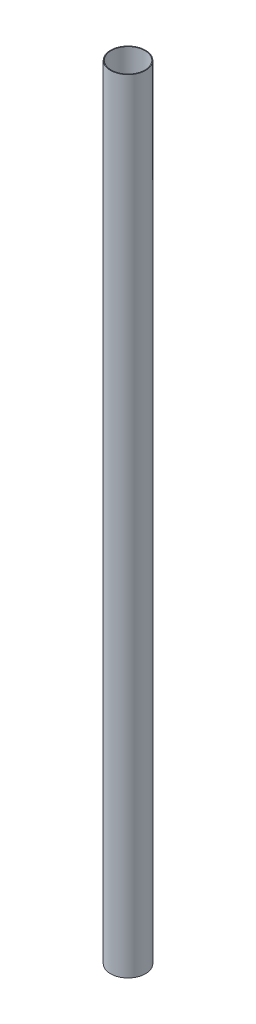
from build123d import *

# Parameters (mm, degrees)
SKETCH1_R           = 28.4734
SKETCH1_R_2         = 27.3304
BOSS_EXTRUDE1_DEPTH = 1270


with BuildPart() as part:
    # Sketch1 → Boss-Extrude1 (new body)
    with BuildSketch(Plane(origin=(0, 0, 0), x_dir=(1, 0, 0), z_dir=(0, 1, 0))):
        Circle(SKETCH1_R)
        Circle(SKETCH1_R_2, mode=Mode.SUBTRACT)
    extrude(amount=BOSS_EXTRUDE1_DEPTH)


solid = part.part
